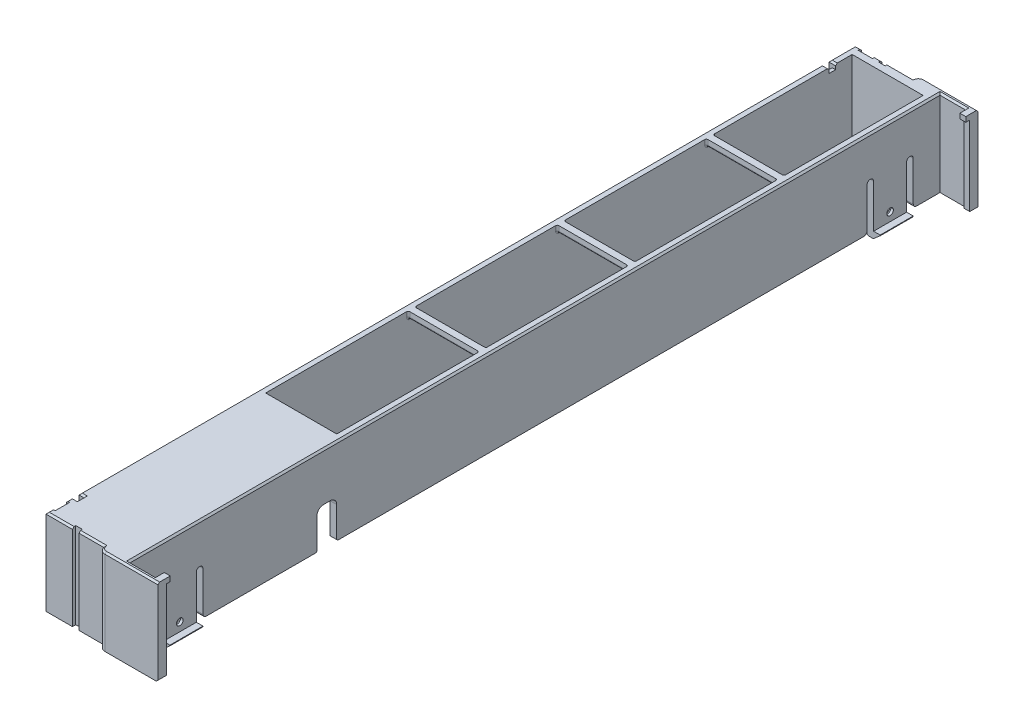
from build123d import *
from OCP.BRepFilletAPI import BRepFilletAPI_MakeChamfer

# Parameters (mm, degrees)
SKETCH1_W            = 25.5
SKETCH1_H            = 245
SKETCH1_W_2          = 21.5
SKETCH1_H_2          = 241
BOSS_EXTRUDE1_DEPTH  = 26
CUT_EXTRUDE4_START   = -1.8
CUT_EXTRUDE4_DEPTH   = 4.4
CUT_EXTRUDE5_START   = -1.8
CUT_EXTRUDE5_DEPTH   = 4.4
BOSS_EXTRUDE3_DEPTH  = 26
FILLET1_R            = 2
CUT_EXTRUDE6_REACH   = 131.333
SKETCH11_W           = 2
SKETCH11_H           = 14
FILLET2_R            = 1
SKETCH12_W           = 10
SKETCH12_H           = 2.1
BOSS_EXTRUDE4_DEPTH  = 2
SKETCH13_W           = 10
SKETCH13_H           = 2
BOSS_EXTRUDE5_DEPTH  = 2
CHAMFER1_SIZE        = 2.1
CHAMFER1_SIZE2       = 1.8
SKETCH15_W           = 1
SKETCH15_H           = 2
SKETCH15_W_2         = 2
SKETCH15_H_2         = 1
CUT_EXTRUDE7_DEPTH   = 26
SKETCH16_W           = 1.8
SKETCH16_H           = 1.2
BOSS_EXTRUDE7_DEPTH  = 1.5
CHAMFER2_SIZE        = 0.5
SKETCH18_W           = 2
SKETCH18_H           = 13
BOSS_EXTRUDE9_DEPTH  = 21.5
CUT_EXTRUDE8_REACH   = 131.259
SKETCH19_W           = 1
SKETCH19_H           = 178.5
SKETCH21_W           = 21.5
SKETCH21_H           = 60.5
SKETCH21_W_2         = 22.5
SKETCH21_H_2         = 2
BOSS_EXTRUDE11_DEPTH = 2
CUT_EXTRUDE9_REACH   = 187.348
SKETCH22_R           = 1.5
CUT_EXTRUDE10_START  = -2
SKETCH23_R           = 1.5
CUT_EXTRUDE10_DEPTH  = 2
SKETCH24_W           = 1
SKETCH24_H           = 2
CUT_EXTRUDE11_DEPTH  = 1.5
CHAMFER3_SIZE        = 0.5
SKETCH25_W           = 21.5
SKETCH25_H           = 2
BOSS_EXTRUDE12_DEPTH = 24
SKETCH26_W           = 15
SKETCH26_H           = 2
CUT_EXTRUDE12_DEPTH  = 1.5
SKETCH27_W           = 6
SKETCH27_H           = 3
BOSS_EXTRUDE13_DEPTH = 22.5
FILLET5_R            = 3
SKETCH28_R           = 0.9
CUT_EXTRUDE13_DEPTH  = 6
SKETCH29_W           = 5
SKETCH29_H           = 1
CUT_EXTRUDE14_DEPTH  = 3
CUT_EXTRUDE15_REACH  = 130.954
SKETCH30_W           = 6
SKETCH30_H           = 11.5
FILLET6_R            = 2
CHAMFER4_SIZE        = 0.3
BOSS_EXTRUDE14_DEPTH = 1
FILLET3_R            = 0.5
CUT_EXTRUDE16_REACH  = 130.954
SKETCH31_R           = 1
FILLET7_R            = 0.5
CHAMFER5_SIZE        = 1.2
CUT_EXTRUDE17_REACH  = 133.67
SKETCH33_R           = 0.9
SKETCH34_W           = 21.5
SKETCH34_H           = 26
SKETCH34_R           = 1.5
BOSS_EXTRUDE15_DEPTH = 1


# Some blends are built 0.0001 mm under size
with BuildPart() as part:
    # Sketch1 → Boss-Extrude1 (new body)
    with BuildSketch(Plane(origin=(0, 0, 0), x_dir=(1, 0, 0), z_dir=(0, 1, 0))):
        Rectangle(SKETCH1_W, SKETCH1_H)
        Rectangle(SKETCH1_W_2, SKETCH1_H_2, mode=Mode.SUBTRACT)
    extrude(amount=BOSS_EXTRUDE1_DEPTH)

    # Sketch5 → Cut-Extrude4 (cut)
    with BuildSketch(Plane.XY.offset(122.5).offset(CUT_EXTRUDE4_START)):
        Polygon((-12.75, 25), (-11.75, 26), (-13.75, 26), (-13.75, 0), (-11.75, 0), (-12.75, 1), (-11.75, 2), (-12.75, 3), (-11.75, 4), (-12.75, 5), (-11.75, 6), (-12.75, 7), (-11.75, 8), (-12.75, 9), (-11.75, 10), (-12.75, 11), (-11.75, 12), (-12.75, 13), (-11.75, 14), (-12.75, 15), (-11.75, 16), (-12.75, 17), (-11.75, 18), (-12.75, 19), (-11.75, 20), (-12.75, 21), (-11.75, 22), (-12.75, 23), (-11.75, 24), align=None)
    extrude(amount=-CUT_EXTRUDE4_DEPTH, mode=Mode.SUBTRACT)

    # Sketch8 → Cut-Extrude5 (cut)
    with BuildSketch(Plane.ZY.offset(12.75).offset(CUT_EXTRUDE5_START)):
        Polygon((-122.5, 25), (-121.5, 26), (-123.5, 26), (-123.5, 0), (-121.5, 0), (-122.5, 1), (-121.5, 2), (-122.5, 3), (-121.5, 4), (-122.5, 5), (-121.5, 6), (-122.5, 7), (-121.5, 8), (-122.5, 9), (-121.5, 10), (-122.5, 11), (-121.5, 12), (-122.5, 13), (-121.5, 14), (-122.5, 15), (-121.5, 16), (-122.5, 17), (-121.5, 18), (-122.5, 19), (-121.5, 20), (-122.5, 21), (-121.5, 22), (-122.5, 23), (-121.5, 24), align=None)
    extrude(amount=-CUT_EXTRUDE5_DEPTH, mode=Mode.SUBTRACT)

    # Sketch10 → Boss-Extrude3 (add)
    with BuildSketch(Plane(origin=(0, 26, 0), x_dir=(1, 0, 0), z_dir=(0, 1, 0))):
        Polygon((4.75, 122.5), (12.75, 122.5), (12.75, 122.6), (20.95, 122.6), (20.95, 121.6), (22.75, 121.6), (22.75, 124.1), (4.75, 124.1), align=None)
        Polygon((20.95, -122.6), (20.95, -121.6), (22.75, -121.6), (22.75, -124.1), (4.75, -124.1), (4.75, -122.5), (12.75, -122.5), (12.75, -122.6), align=None)
    extrude(amount=-BOSS_EXTRUDE3_DEPTH)

    # Fillet1
    # the kernel refuses this fillet: 2 mm, written as the material it takes off along each edge
    with BuildSketch(Plane(origin=(4.75, 30.898979486, 124.1), x_dir=(1.5776269179918486e-12, 0, -1.0), z_dir=(0, -1, 0))) as fillet1_piece_1:
        with BuildLine():
            CenterArc((2, 1.959591794), FILLET1_R, 180, 78.463040967)
            Line((0, 1.959591794), (-0.04, 1.959591794))
            Line((-0.04, 1.959591794), (-0.04, 0))
            Line((-0.04, 0), (0, -0.04))
            ThreePointArc((0, -0.04), (0.8, -0.04), (1.592, -0.039191836))
            Line((1.592, -0.039191836), (1.6, 0))
        make_face()
    extrude(amount=35.797958971, mode=Mode.SUBTRACT)
    with BuildSketch(Plane(origin=(4.75, 30.898979486, -124.1), x_dir=(1, 0, 0), z_dir=(0, -1, 0))) as fillet1_piece_2:
        with BuildLine():
            CenterArc((1.959591794, 2), FILLET1_R, 191.536959033, 78.463040967)
            Line((0, 1.6), (-0.039191836, 1.592))
            ThreePointArc((-0.039191836, 1.592), (-0.04, 0.8), (-0.04, 0))
            Line((-0.04, 0), (0, -0.04))
            Line((0, -0.04), (1.959591794, -0.04))
            Line((1.959591794, -0.04), (1.959591794, 0))
        make_face()
    extrude(amount=35.797958971, mode=Mode.SUBTRACT)

    # Sketch11 → Cut-Extrude6 (cut, up to next)
    with BuildSketch(Plane(origin=(12.75, 0, 0), x_dir=(0, 0, -1), z_dir=(1, 0, 0)), mode=Mode.PRIVATE) as cut_extrude6_sk1:
        with Locations((-113.5, 7)):
            Rectangle(SKETCH11_W, SKETCH11_H)
    cut_extrude6_tool1 = extrude(cut_extrude6_sk1.sketch, amount=-CUT_EXTRUDE6_REACH, mode=Mode.PRIVATE) & part.part
    # Sketch11 → Cut-Extrude6 (cut, up to next)
    with BuildSketch(Plane(origin=(12.75, 0, 0), x_dir=(0, 0, -1), z_dir=(1, 0, 0)), mode=Mode.PRIVATE) as cut_extrude6_sk2:
        with Locations((-101.5, 7)):
            Rectangle(SKETCH11_W, SKETCH11_H)
    cut_extrude6_tool2 = extrude(cut_extrude6_sk2.sketch, amount=-CUT_EXTRUDE6_REACH, mode=Mode.PRIVATE) & part.part
    # Sketch11 → Cut-Extrude6 (cut, up to next)
    with BuildSketch(Plane(origin=(12.75, 0, 0), x_dir=(0, 0, -1), z_dir=(1, 0, 0)), mode=Mode.PRIVATE) as cut_extrude6_sk3:
        with Locations((101.5, 7)):
            Rectangle(SKETCH11_W, SKETCH11_H)
    cut_extrude6_tool3 = extrude(cut_extrude6_sk3.sketch, amount=-CUT_EXTRUDE6_REACH, mode=Mode.PRIVATE) & part.part
    # Sketch11 → Cut-Extrude6 (cut, up to next)
    with BuildSketch(Plane(origin=(12.75, 0, 0), x_dir=(0, 0, -1), z_dir=(1, 0, 0)), mode=Mode.PRIVATE) as cut_extrude6_sk4:
        with Locations((113.5, 7)):
            Rectangle(SKETCH11_W, SKETCH11_H)
    cut_extrude6_tool4 = extrude(cut_extrude6_sk4.sketch, amount=-CUT_EXTRUDE6_REACH, mode=Mode.PRIVATE) & part.part
    add(cut_extrude6_tool1.solids().sort_by_distance((12.75, 7, 113.5))[0], mode=Mode.SUBTRACT)
    add(cut_extrude6_tool2.solids().sort_by_distance((12.75, 7, 101.5))[0], mode=Mode.SUBTRACT)
    add(cut_extrude6_tool3.solids().sort_by_distance((12.75, 7, -101.5))[0], mode=Mode.SUBTRACT)
    add(cut_extrude6_tool4.solids().sort_by_distance((12.75, 7, -113.5))[0], mode=Mode.SUBTRACT)

    # Fillet2
    fillet2_edges = [part.edges().sort_by_distance(p)[0] for p in [
        (11.75, 14, -112.5),
        (11.75, 14, -100.5),
        (11.75, 0, -100.5),
        (11.75, 0, -114.5),
        (11.75, 14, -114.5),
        (11.75, 14, -102.5),
        (11.75, 0, 100.5),
        (11.75, 14, 100.5),
        (11.75, 14, 114.5),
        (11.75, 0, 114.5),
        (11.75, 14, 102.5),
        (11.75, 14, 112.5),
    ]]
    fillet(fillet2_edges, radius=FILLET2_R - 0.0001)  # a hair under: the kernel refuses the full size

    # Sketch12 → Boss-Extrude4 (add)
    with BuildSketch(Plane(origin=(12.75, 0, 0), x_dir=(0, 0, -1), z_dir=(1, 0, 0))):
        with Locations((-107.5, -1.05)):
            Rectangle(SKETCH12_W, SKETCH12_H)
        with Locations((107.5, -1.05)):
            Rectangle(SKETCH12_W, SKETCH12_H)
    extrude(amount=-BOSS_EXTRUDE4_DEPTH)

    # Sketch13 → Boss-Extrude5 (add)
    with BuildSketch(Plane(origin=(12.75, 0, 0), x_dir=(0, 0, -1), z_dir=(1, 0, 0))):
        with Locations((-107.5, -1.1)):
            Rectangle(SKETCH13_W, SKETCH13_H)
        with Locations((107.5, -1.1)):
            Rectangle(SKETCH13_W, SKETCH13_H)
    extrude(amount=BOSS_EXTRUDE5_DEPTH)

    # Chamfer1: one chamfer whose edges measure the first distance from different faces: ONE call of the kernel's chamfer builder (chamfer() names one face for all edges)
    chamfer1_edges_1 = [part.edges().sort_by_distance(p)[0] for p in [
        (14.75, -2.1, 107.5),
    ]]
    chamfer1_side_1 = [part.faces().sort_by_distance(p)[0] for p in [
        (12.75, -2.1, 107.5),
    ]]
    chamfer1_edges_2 = [part.edges().sort_by_distance(p)[0] for p in [
        (14.75, -2.1, -107.5),
    ]]
    chamfer1_side_2 = [part.faces().sort_by_distance(p)[0] for p in [
        (12.75, -2.1, -107.5),
    ]]
    chamfer1 = BRepFilletAPI_MakeChamfer(part.part.solid().wrapped)
    for e in chamfer1_edges_1:
        chamfer1.Add(CHAMFER1_SIZE, CHAMFER1_SIZE2, e.wrapped, chamfer1_side_1[0].wrapped)  # the first distance lies on this face
    for e in chamfer1_edges_2:
        chamfer1.Add(CHAMFER1_SIZE, CHAMFER1_SIZE2, e.wrapped, chamfer1_side_2[0].wrapped)  # the first distance lies on this face
    add(Compound.cast(chamfer1.Shape()), mode=Mode.REPLACE)

    # Sketch15 → Cut-Extrude7 (cut)
    with BuildSketch(Plane(origin=(0, 26, 0), x_dir=(1, 0, 0), z_dir=(0, 1, 0))):
        with Locations((-12.25, -113.5)):
            Rectangle(SKETCH15_W, SKETCH15_H)
        with Locations((-3.75, -122)):
            Rectangle(SKETCH15_W_2, SKETCH15_H_2)
        with Locations((-3.75, 122)):
            Rectangle(SKETCH15_W_2, SKETCH15_H_2)
        with Locations((-12.25, 113.5)):
            Rectangle(SKETCH15_W, SKETCH15_H)
    extrude(amount=-CUT_EXTRUDE7_DEPTH, mode=Mode.SUBTRACT)

    # Sketch16 → Boss-Extrude7 (add)
    with BuildSketch(Plane(origin=(0, 26, 0), x_dir=(1, 0, 0), z_dir=(0, 1, 0))):
        with Locations((21.85, 121)):
            Rectangle(SKETCH16_W, SKETCH16_H)
        with Locations((21.85, -121)):
            Rectangle(SKETCH16_W, SKETCH16_H)
    extrude(amount=-BOSS_EXTRUDE7_DEPTH)

    # Chamfer2
    chamfer2_edges = [part.edges().sort_by_distance(p)[0] for p in [
        (12.75, 26, 0),
        (-11.85, 26, -122.5),
        (1, 26, -122.5),
        (16.85, 26, -122.6),
        (14.729795897, 26, -124.1),
        (22.75, 0, -122.85),
        (21.85, 0, -121.6),
        (20.95, 0, -122.1),
        (16.85, 26, 122.6),
        (20.95, 0, 122.1),
        (21.85, 0, 121.6),
        (22.75, 0, 122.85),
        (14.729795897, 26, 124.1),
        (5.44468073, 26, -123.649193338),
        (5.44468073, 26, 123.649193338),
        (-12.75, 26, 121.6),
        (-12.75, 26, -118.5),
        (-12.75, 26, 115.4),
        (1, 26, 122.5),
        (-5.65, 26, -122.5),
        (-12.75, 26, 0),
        (-8.75, 26, 122.5),
    ]]
    chamfer(chamfer2_edges, length=CHAMFER2_SIZE)

    # Sketch18 → Boss-Extrude9 (add)
    with BuildSketch(Plane.ZY.offset(-10.75)):
        with Locations((59, 19.5)):
            Rectangle(SKETCH18_W, SKETCH18_H)
    extrude(amount=BOSS_EXTRUDE9_DEPTH)

    # Cut-Extrude8: up to this face of the body (flat: up to its plane)
    cut_extrude8_end = Plane(part.part.faces().sort_by_distance((11.7, -2.1, -107.5))[0])
    # Sketch19 → Cut-Extrude8 (cut, up to the picked face)
    with BuildSketch(Plane(origin=(0, 26, 0), x_dir=(1, 0, 0), z_dir=(0, 1, 0)), mode=Mode.PRIVATE) as cut_extrude8_sk1:
        with Locations((11.25, 31.25)):
            Rectangle(SKETCH19_W, SKETCH19_H)
    cut_extrude8_tool1 = split(extrude(cut_extrude8_sk1.sketch, amount=-CUT_EXTRUDE8_REACH, mode=Mode.PRIVATE), bisect_by=cut_extrude8_end, keep=Keep.BOTH, mode=Mode.PRIVATE)
    add(cut_extrude8_tool1.solids().sort_by(Axis((11.25, 26, -31.25), (0, -1, 0)))[0], mode=Mode.SUBTRACT)

    # Sketch21 → Boss-Extrude11 (add)
    with BuildSketch(Plane(origin=(0, 26, 0), x_dir=(1, 0, 0), z_dir=(0, 1, 0))):
        with Locations((0, -90.25)):
            Rectangle(SKETCH21_W, SKETCH21_H)
        with Locations((0.5, -13.875)):
            Rectangle(SKETCH21_W_2, SKETCH21_H_2)
        with Locations((0.5, 31.25)):
            Rectangle(SKETCH21_W_2, SKETCH21_H_2)
        with Locations((0.5, 76.375)):
            Rectangle(SKETCH21_W_2, SKETCH21_H_2)
    extrude(amount=-BOSS_EXTRUDE11_DEPTH)

    # Sketch22 → Cut-Extrude9 (cut, up to next)
    with BuildSketch(Plane(origin=(0, 0, 58), x_dir=(-1, 0, 0), z_dir=(0, 0, -1)), mode=Mode.PRIVATE) as cut_extrude9_sk1:
        with Locations((0, 13)):
            Circle(SKETCH22_R)
    cut_extrude9_tool1 = extrude(cut_extrude9_sk1.sketch, amount=-CUT_EXTRUDE9_REACH, mode=Mode.PRIVATE) & part.part
    add(cut_extrude9_tool1.solids().sort_by_distance((0, 13, 58))[0], mode=Mode.SUBTRACT)

    # Sketch23 → Cut-Extrude10 (cut)
    with BuildSketch(Plane.XY.offset(-120.5).offset(CUT_EXTRUDE10_START)):
        with Locations((0, 13)):
            Circle(SKETCH23_R)
    extrude(amount=CUT_EXTRUDE10_DEPTH, mode=Mode.SUBTRACT)

    # Sketch24 → Cut-Extrude11 (cut)
    with BuildSketch(Plane(origin=(0, 26, 0), x_dir=(1, 0, 0), z_dir=(0, 1, 0))):
        with Locations((-11.25, 113.5)):
            Rectangle(SKETCH24_W, SKETCH24_H)
        with Locations((-11.25, -113.5)):
            Rectangle(SKETCH24_W, SKETCH24_H)
    extrude(amount=-CUT_EXTRUDE11_DEPTH, mode=Mode.SUBTRACT)

    # Chamfer3
    chamfer3_edges = [part.edges().sort_by_distance(p)[0] for p in [
        (-11.5, 26, -114.5),
        (-11.5, 26, -112.5),
        (-11.5, 26, 112.5),
        (-11.5, 26, 114.5),
    ]]
    chamfer(chamfer3_edges, length=CHAMFER3_SIZE)

    # Sketch25 → Boss-Extrude12 (add)
    with BuildSketch(Plane.XZ.offset(-24)):
        with Locations((0, 71)):
            Rectangle(SKETCH25_W, SKETCH25_H)
    extrude(amount=BOSS_EXTRUDE12_DEPTH)

    # Sketch26 → Cut-Extrude12 (cut)
    with BuildSketch(Plane.XZ):
        with Locations((0, 71)):
            Rectangle(SKETCH26_W, SKETCH26_H)
    extrude(amount=-CUT_EXTRUDE12_DEPTH, mode=Mode.SUBTRACT)

    # Sketch27 → Boss-Extrude13 (add)
    with BuildSketch(Plane.XZ.offset(-1.5)):
        with Locations((0, 68.5)):
            Rectangle(SKETCH27_W, SKETCH27_H)
    extrude(amount=-BOSS_EXTRUDE13_DEPTH)

    # Fillet5
    fillet5_edges = [part.edges().sort_by_distance(p)[0] for p in [
        (3, 12.75, 67),
        (-3, 12.75, 67),
    ]]
    fillet(fillet5_edges, radius=FILLET5_R - 0.0001)  # a hair under: the kernel refuses the full size

    # Sketch28 → Cut-Extrude13 (cut)
    with BuildSketch(Plane.XZ.offset(-1.5)):
        with Locations(Location((0, 69.5, 0), (0, 0, 270))):
            Circle(SKETCH28_R)
    extrude(amount=-CUT_EXTRUDE13_DEPTH, mode=Mode.SUBTRACT)

    # Sketch29 → Cut-Extrude14 (cut)
    with BuildSketch(Plane.XZ.offset(-13)):
        with Locations((8.25, 59.5)):
            Rectangle(SKETCH29_W, SKETCH29_H)
        with Locations((-8.25, 59.5)):
            Rectangle(SKETCH29_W, SKETCH29_H)
    extrude(amount=-CUT_EXTRUDE14_DEPTH, mode=Mode.SUBTRACT)

    # Sketch30 → Cut-Extrude15 (cut, up to next)
    with BuildSketch(Plane.ZY.offset(-10.75), mode=Mode.PRIVATE) as cut_extrude15_sk1:
        with Locations((63, 5.75)):
            Rectangle(SKETCH30_W, SKETCH30_H)
    cut_extrude15_tool1 = extrude(cut_extrude15_sk1.sketch, amount=-CUT_EXTRUDE15_REACH, mode=Mode.PRIVATE) & part.part
    add(cut_extrude15_tool1.solids().sort_by_distance((10.75, 5.75, 63))[0], mode=Mode.SUBTRACT)

    # Fillet6
    fillet6_edges = [part.edges().sort_by_distance(p)[0] for p in [
        (11.75, 11.5, 60),
        (11.75, 11.5, 66),
    ]]
    fillet(fillet6_edges, radius=FILLET6_R)

    # Chamfer4
    chamfer4_edges = [part.edges().sort_by_distance(p)[0] for p in [
        (7.5, 0, 71),
        (-7.5, 0, 71),
        (11.75, 0, 60),
        (11.75, 0, 66),
    ]]
    chamfer(chamfer4_edges, length=CHAMFER4_SIZE)

    # Sketch32 → Boss-Extrude14 (add)
    with BuildSketch(Plane.ZY.offset(-11.75)):
        with BuildLine():
            Line((-120.5, 26), (58, 26))
            Line((58, 26), (58, 0))
            Line((58, 0), (-99.5, 0))
            ThreePointArc((-99.5, 0), (-100.207106781, 0.292893219), (-100.5, 1))
            Line((-100.5, 1), (-100.5, 13))
            ThreePointArc((-100.5, 13), (-100.792893219, 13.707106781), (-101.5, 14))
            ThreePointArc((-101.5, 14), (-102.207106781, 13.707106781), (-102.5, 13))
            Line((-102.5, 13), (-102.5, -2.1))
            Line((-102.5, -2.1), (-112.5, -2.1))
            Line((-112.5, -2.1), (-112.5, 13))
            ThreePointArc((-112.5, 13), (-112.792893219, 13.707106781), (-113.5, 14))
            ThreePointArc((-113.5, 14), (-114.207106781, 13.707106781), (-114.5, 13))
            Line((-114.5, 13), (-114.5, 1))
            ThreePointArc((-114.5, 1), (-114.792893219, 0.292893219), (-115.5, 0))
            Line((-115.5, 0), (-120.5, 0))
            Line((-120.5, 0), (-120.5, 26))
        make_face()
    extrude(amount=BOSS_EXTRUDE14_DEPTH)

    # Fillet3
    fillet3_edges = [part.edges().sort_by_distance(p)[0] for p in [
        (10.75, -2.1, -107.5),
        (10.75, -2.1, 107.5),
    ]]
    fillet(fillet3_edges, radius=FILLET3_R)

    # Sketch31 → Cut-Extrude16 (cut, up to next)
    with BuildSketch(Plane.ZY.offset(-10.75), mode=Mode.PRIVATE) as cut_extrude16_sk1:
        with Locations((-107.5, 2.5)):
            Circle(SKETCH31_R)
    cut_extrude16_tool1 = extrude(cut_extrude16_sk1.sketch, amount=-CUT_EXTRUDE16_REACH, mode=Mode.PRIVATE) & part.part
    # Sketch31 → Cut-Extrude16 (cut, up to next)
    with BuildSketch(Plane.ZY.offset(-10.75), mode=Mode.PRIVATE) as cut_extrude16_sk2:
        with Locations((107.5, 2.5)):
            Circle(SKETCH31_R)
    cut_extrude16_tool2 = extrude(cut_extrude16_sk2.sketch, amount=-CUT_EXTRUDE16_REACH, mode=Mode.PRIVATE) & part.part
    add(cut_extrude16_tool1.solids().sort_by_distance((10.75, 2.5, -107.5))[0], mode=Mode.SUBTRACT)
    add(cut_extrude16_tool2.solids().sort_by_distance((10.75, 2.5, 107.5))[0], mode=Mode.SUBTRACT)

    # Fillet7
    fillet7_edges = [part.edges().sort_by_distance(p)[0] for p in [
        (0, 24, -77.375),
        (10.75, 24, -76.375),
        (0, 24, -32.25),
        (0, 24, 12.875),
        (10.75, 24, 13.875),
        (10.75, 24, -31.25),
        (10.75, 25, 14.875),
        (10.75, 25, 12.875),
        (10.75, 25, -30.25),
        (10.75, 25, -32.25),
        (10.75, 25, -75.375),
        (10.75, 25, -77.375),
        (0, 24, 14.875),
        (-10.75, 24, 13.875),
        (-10.75, 25, 14.875),
        (-10.75, 25, 12.875),
        (0, 24, -30.25),
        (-10.75, 24, -31.25),
        (-10.75, 25, -30.25),
        (-10.75, 25, -32.25),
        (0, 24, -75.375),
        (-10.75, 24, -76.375),
        (-10.75, 25, -75.375),
        (-10.75, 25, -77.375),
    ]]
    fillet(fillet7_edges, radius=FILLET7_R)

    # Chamfer5
    chamfer5_edges = [part.edges().sort_by_distance(p)[0] for p in [
        (10.75, 2.5, -108.5),
        (10.75, 2.5, 106.5),
    ]]
    chamfer(chamfer5_edges, length=CHAMFER5_SIZE)

    # Sketch33 → Cut-Extrude17 (cut, up to next)
    with BuildSketch(Plane.ZY.offset(12.75), mode=Mode.PRIVATE) as cut_extrude17_sk1:
        with Locations((107.5, 2.5)):
            Circle(SKETCH33_R)
    cut_extrude17_tool1 = extrude(cut_extrude17_sk1.sketch, amount=-CUT_EXTRUDE17_REACH, mode=Mode.PRIVATE) & part.part
    add(cut_extrude17_tool1.solids().sort_by_distance((-12.75, 2.5, 107.5))[0], mode=Mode.SUBTRACT)

    # Sketch34 → Boss-Extrude15 (add)
    with BuildSketch(Plane.XY.offset(-120.5)):
        with Locations((0, 13)):
            Rectangle(SKETCH34_W, SKETCH34_H)
        with Locations((0, 13)):
            Circle(SKETCH34_R, mode=Mode.SUBTRACT)
    extrude(amount=BOSS_EXTRUDE15_DEPTH)


solid = part.part
